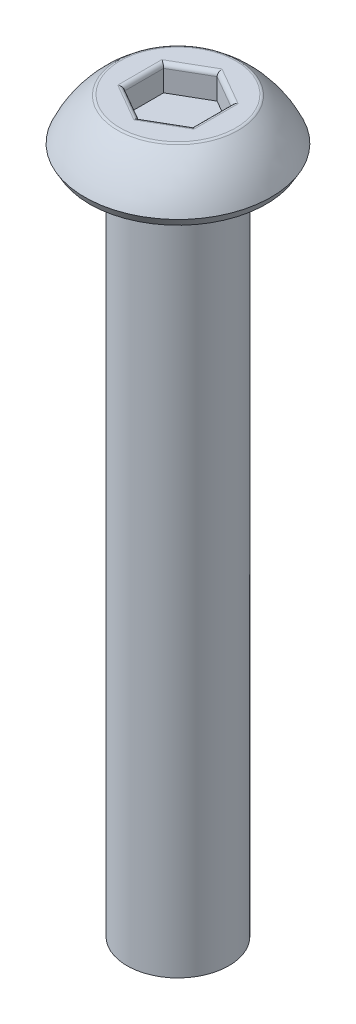
from build123d import *

# Parameters (mm, degrees)
CUT_EXTRUDE1_DEPTH = 0.75
FILLET1_R          = 0.125


with BuildPart() as part:
    # Sketch1 → Revolve1 (revolve)
    with BuildSketch(Plane(origin=(0, 0, 0), x_dir=(0, 0, -1), z_dir=(1, 0, 0))):
        with BuildLine():
            Line((0, 1.5), (-1.75, 1.5))
            ThreePointArc((-1.75, 1.5), (-2.334912942, 0.942930354), (-2.75, 0.25))
            Line((-2.75, 0.25), (-2.605662433, 0))
            Line((-2.605662433, 0), (-1.5, 0))
            Line((-1.5, 0), (-1.5, -20))
            Line((-1.5, -20), (0, -20))
            Line((0, -20), (0, 1.5))
        make_face()
    revolve(axis=Axis((0, -20, 0), (0, 1, 0)))

    # Sketch2 → Cut-Extrude1 (cut)
    with BuildSketch(Plane(origin=(0, 1.5, 0), x_dir=(1, 0, 0), z_dir=(0, 1, 0))):
        Polygon((0, 1.154700538), (-1, 0.577350269), (-1, -0.577350269), (0, -1.154700538), (1, -0.577350269), (1, 0.577350269), align=None)
    extrude(amount=-CUT_EXTRUDE1_DEPTH, mode=Mode.SUBTRACT)

    # Fillet1
    fillet1_edges = [part.edges().sort_by_distance(p)[0] for p in [
        (0, 1.5, -1.75),
        (-0.5, 1.5, 0.866025404),
        (0.5, 1.5, 0.866025404),
        (1, 1.5, 0),
        (0.5, 1.5, -0.866025404),
        (-0.5, 1.5, -0.866025404),
        (-1, 1.5, 0),
    ]]
    fillet(fillet1_edges, radius=FILLET1_R)


solid = part.part
